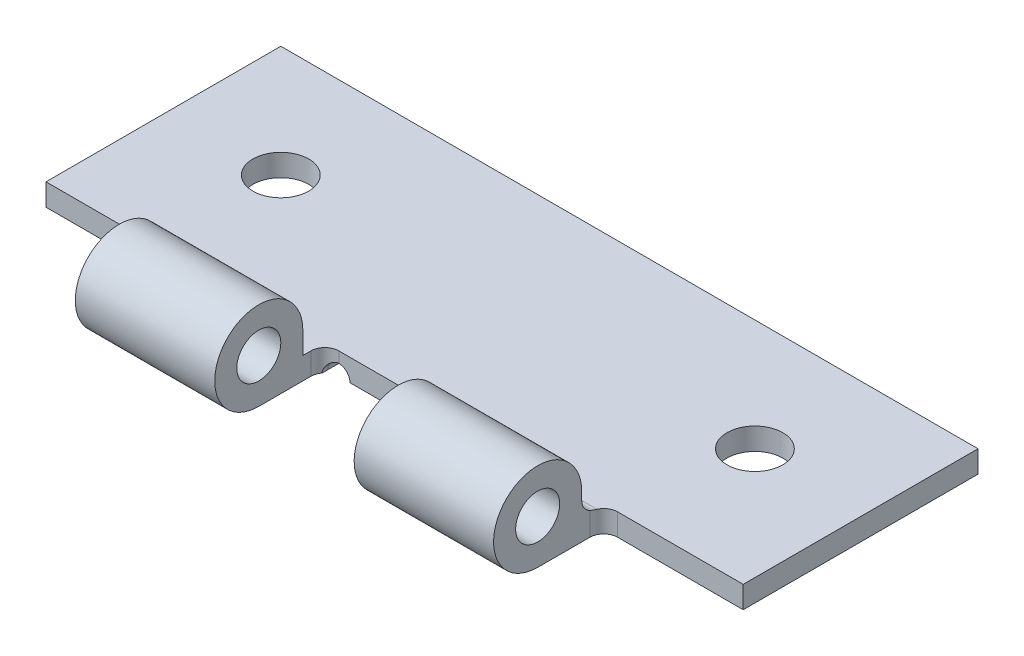
from build123d import *

# Parameters (mm, degrees)
SKETCH1_W           = 25
SKETCH1_H           = 10
BASE_PLATE_DEPTH    = 0.79
SKETCH5_R           = 0.79
PIN_HOLDER_DEPTH    = 5
FILLET1_R           = 0.5
SKETCH6_R           = 1
SCREW_HOLES_DEPTH   = 5
SKETCH7_W           = 5
SKETCH7_H           = 0.79
HINGE_GROOVES_DEPTH = 1.58
FILLET2_R           = 0.5
SKETCH8_R           = 0.4


with BuildPart() as part:
    # Sketch1 → Base Plate (new body)
    with BuildSketch(Plane(origin=(0, 0, 0), x_dir=(1, 0, 0), z_dir=(0, 1, 0))):
        with Locations((4.767605634, 0.253521127)):
            Rectangle(SKETCH1_W, SKETCH1_H)
    extrude(amount=BASE_PLATE_DEPTH)

    # Sketch5 → Pin Holder (add)
    with BuildSketch(Plane(origin=(12.267605634, 0, 0), x_dir=(0, 0, -1), z_dir=(1, 0, 0))):
        with BuildLine():
            Line((-3.956478873, 1.58), (-3.956478873, 0.79))
            ThreePointArc((-3.956478873, 0.79), (-4.187864516, 0.231385643), (-4.746478873, 0))
            Line((-4.746478873, 0), (-5.536478873, 0))
            ThreePointArc((-5.536478873, 0), (-6.653707588, 2.697228714), (-3.956478873, 1.58))
        make_face()
        with Locations((-5.536478873, 1.58)):
            Circle(SKETCH5_R, mode=Mode.SUBTRACT)
    pin_holder = extrude(amount=-PIN_HOLDER_DEPTH)

    # Fillet1
    fillet1_edges = [part.edges().sort_by_distance(p)[0] for p in [
        (9.767605634, 0.79, 3.956478873),
    ]]
    fillet(fillet1_edges, radius=FILLET1_R)

    # Sketch6 → Screw Holes (cut)
    with BuildSketch(Plane(origin=(0, 0.79, 0), x_dir=(1, 0, 0), z_dir=(0, 1, 0))):
        with Locations((13.267605634, 1.253521127)):
            Circle(SKETCH6_R)
    screw_holes = extrude(amount=-SCREW_HOLES_DEPTH, mode=Mode.SUBTRACT)

    # Mirror1: Pin Holder, Screw Holes across plane
    add(pin_holder.mirror(Plane(origin=(4.767605634, 0, 0), x_dir=(0, 0, 1), z_dir=(1, 0, 0))))
    add(screw_holes.mirror(Plane(origin=(4.767605634, 0, 0), x_dir=(0, 0, 1), z_dir=(1, 0, 0))), mode=Mode.SUBTRACT)

    # Sketch7 → Hinge Grooves (cut)
    with BuildSketch(Plane.XY.offset(4.746478873)):
        with Locations((14.767605634, 0.395)):
            Rectangle(SKETCH7_W, SKETCH7_H)
        with Locations((4.767605634, 0.395)):
            Rectangle(SKETCH7_W, SKETCH7_H)
        with Locations((-5.232394366, 0.395)):
            Rectangle(SKETCH7_W, SKETCH7_H)
    extrude(amount=-HINGE_GROOVES_DEPTH, mode=Mode.SUBTRACT)

    # Fillet2
    fillet2_edges = [part.edges().sort_by_distance(p)[0] for p in [
        (7.267605634, 0.395, 3.166478873),
    ]]
    fillet(fillet2_edges, radius=FILLET2_R)
    fillet2_2_edges = [part.edges().sort_by_distance(p)[0] for p in [
        (12.267605634, 0.395, 3.166478873),
    ]]
    fillet(fillet2_2_edges, radius=FILLET2_R)
    fillet2_3_edges = [part.edges().sort_by_distance(p)[0] for p in [
        (-2.732394366, 0.395, 3.166478873),
    ]]
    fillet(fillet2_3_edges, radius=FILLET2_R)
    fillet2_4_edges = [part.edges().sort_by_distance(p)[0] for p in [
        (2.267605634, 0.395, 3.166478873),
    ]]
    fillet(fillet2_4_edges, radius=FILLET2_R)

    # Wire Groove: sweep along a path in Sketch9
    with BuildLine(Plane.XZ) as wire_groove_path:
        Line((2.767605634, -5.253521127), (2.767605634, 3.166478873))
        Line((2.767605634, 3.166478873), (2.767605634, 3.884059602))
    # Sketch8 → Wire Groove (sweep, cut)
    with BuildSketch(Plane(origin=(0, 0, -5.253521127), x_dir=(-1, 0, 0), z_dir=(0, 0, -1))):
        with Locations((-2.767605634, 0)):
            Circle(SKETCH8_R)
    sweep(path=wire_groove_path.line, mode=Mode.SUBTRACT)


solid = part.part
